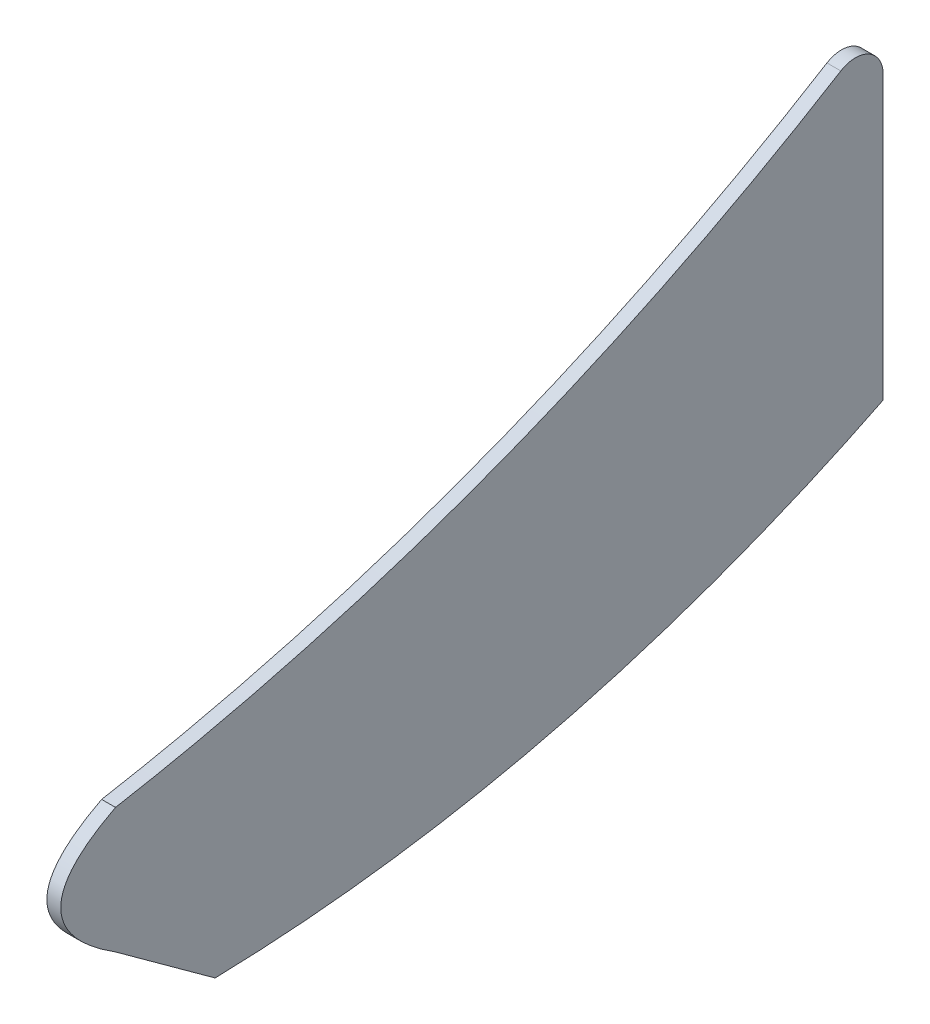
from build123d import *

# Parameters (mm, degrees)
BOSS_EXTRUDE1_DEPTH = 12.7
FILLET1_R           = 25.4
FILLET2_R           = 25.4


with BuildPart() as part:
    # Sketch1 → Boss-Extrude1 (new body)
    with BuildSketch(Plane(origin=(0, 0, 0), x_dir=(0, 0, -1), z_dir=(1, 0, 0))):
        with BuildLine():
            Line((552.210156901, -51.434482431), (552.210156901, 253.365517569))
            add(Edge.make_bspline(
                [(552.210156901, 253.365517569), (229.842048286, 44.573189665), (-150.507944751, -22.97883784)],
                knots=[0, 0, 0, 1, 1, 1], degree=2))
            add(Edge.make_bspline(
                [(-150.507944751, -22.97883784), (-250.760296622, -74.460252601), (-150.507944751, -137.593021529)],
                knots=[0, 0, 0, 1, 1, 1], degree=2))
            Line((-150.507944751, -137.593021529), (-59.310339097, -203.834480101))
            add(Edge.make_bspline(
                [(-59.310339097, -203.834480101), (261.653002312, -195.881315467), (552.210156901, -51.434482431)],
                knots=[0, 0, 0, 1, 1, 1], degree=2))
        make_face()
    extrude(amount=BOSS_EXTRUDE1_DEPTH)

    # Fillet1
    fillet1_edges = [part.edges().sort_by_distance(p)[0] for p in [
        (6.35, 253.365517569, -552.210156901),
    ]]
    fillet(fillet1_edges, radius=FILLET1_R)

    # Fillet2
    # the kernel refuses this fillet: 25.4 mm, written as the material it adds along each edge
    with BuildSketch(Plane(origin=(0, -137.593021529, 150.507944751), x_dir=(0, -0.5876837443751272, -0.8090907344650724), z_dir=(1, 0, 0))) as fillet2_piece_1:
        with BuildLine():
            CenterArc((0.823180345, -25.4), FILLET2_R, 90, 3.635270522)
            ThreePointArc((-0.787303597, -0.051107687), (-0.393634255, -0.025824092), (0, 0))
            Line((0, 0), (0.823180345, 0))
        make_face()
    extrude(amount=12.7)


solid = part.part
